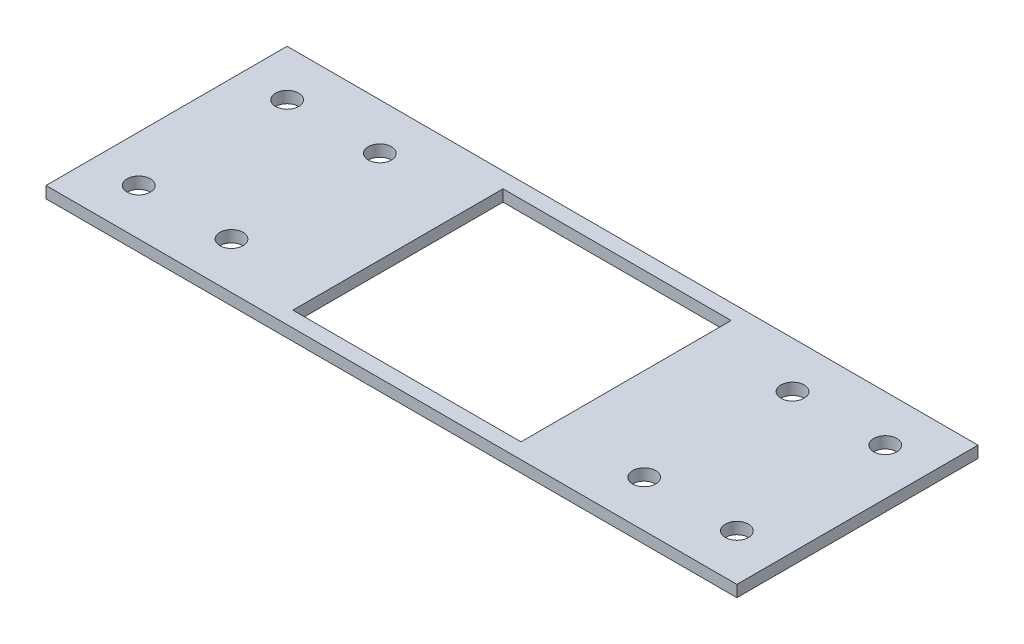
from build123d import *

# Parameters (mm, degrees)
SKETCH1_W           = 138.43
SKETCH1_H           = 66.04
BOSS_EXTRUDE1_DEPTH = 25.4
CUT_EXTRUDE1_REACH  = 146.563
SKETCH2_W           = 66.04
SKETCH2_H           = 22.225
SKETCH3_R           = 3.175
CUT_EXTRUDE2_DEPTH  = 77.753613921
SKETCH5_W           = 66.04
SKETCH5_H           = 3.175
BOSS_EXTRUDE2_DEPTH = 25.4
SKETCH7_W           = 66.04
SKETCH7_H           = 3.175
BOSS_EXTRUDE3_DEPTH = 25.4
CUT_EXTRUDE3_REACH  = 102.262
SKETCH8_R           = 3.175
SKETCH9_W           = 62.484
SKETCH9_H           = 57.5689222
CUT_EXTRUDE4_DEPTH  = 101.261653936


with BuildPart() as part:
    # Sketch1 → Boss-Extrude1 (new body)
    with BuildSketch(Plane(origin=(0, 0, 0), x_dir=(1, 0, 0), z_dir=(0, 1, 0))):
        Rectangle(SKETCH1_W, SKETCH1_H)
    extrude(amount=BOSS_EXTRUDE1_DEPTH)

    # Sketch2 → Cut-Extrude1 (cut, up to next)
    with BuildSketch(Plane.ZY.offset(69.215), mode=Mode.PRIVATE) as cut_extrude1_sk1:
        with Locations((0, 11.1125)):
            Rectangle(SKETCH2_W, SKETCH2_H)
    cut_extrude1_tool1 = extrude(cut_extrude1_sk1.sketch, amount=-CUT_EXTRUDE1_REACH, mode=Mode.PRIVATE) & part.part
    add(cut_extrude1_tool1.solids().sort_by_distance((-69.215, 11.1125, 0))[0], mode=Mode.SUBTRACT)

    # Sketch3 → Cut-Extrude2 (cut, through all)
    with BuildSketch(Plane(origin=(0, 25.4, 0), x_dir=(1, 0, 0), z_dir=(0, 1, 0))):
        with Locations((-56.515, 20.32)):
            Circle(SKETCH3_R)
        with Locations((-56.515, -20.32)):
            Circle(SKETCH3_R)
        with Locations((56.515, -20.32)):
            Circle(SKETCH3_R)
        with Locations((56.515, 20.32)):
            Circle(SKETCH3_R)
    extrude(amount=-CUT_EXTRUDE2_DEPTH, mode=Mode.SUBTRACT)

    # Sketch5 → Boss-Extrude2 (add)
    with BuildSketch(Plane.ZY.offset(69.215)):
        with Locations((0, 23.8125)):
            Rectangle(SKETCH5_W, SKETCH5_H)
    extrude(amount=BOSS_EXTRUDE2_DEPTH)

    # Sketch7 → Boss-Extrude3 (add)
    with BuildSketch(Plane(origin=(69.215, 0, 0), x_dir=(0, 0, -1), z_dir=(1, 0, 0))):
        with Locations((0, 23.8125)):
            Rectangle(SKETCH7_W, SKETCH7_H)
    extrude(amount=BOSS_EXTRUDE3_DEPTH)

    # Sketch8 → Cut-Extrude3 (cut, up to next)
    with BuildSketch(Plane(origin=(0, 25.4, 0), x_dir=(1, 0, 0), z_dir=(0, 1, 0)), mode=Mode.PRIVATE) as cut_extrude3_sk1:
        with Locations((-81.915, 20.32)):
            Circle(SKETCH8_R)
    cut_extrude3_tool1 = extrude(cut_extrude3_sk1.sketch, amount=-CUT_EXTRUDE3_REACH, mode=Mode.PRIVATE) & part.part
    # Sketch8 → Cut-Extrude3 (cut, up to next)
    with BuildSketch(Plane(origin=(0, 25.4, 0), x_dir=(1, 0, 0), z_dir=(0, 1, 0)), mode=Mode.PRIVATE) as cut_extrude3_sk2:
        with Locations((-81.915, -20.32)):
            Circle(SKETCH8_R)
    cut_extrude3_tool2 = extrude(cut_extrude3_sk2.sketch, amount=-CUT_EXTRUDE3_REACH, mode=Mode.PRIVATE) & part.part
    # Sketch8 → Cut-Extrude3 (cut, up to next)
    with BuildSketch(Plane(origin=(0, 25.4, 0), x_dir=(1, 0, 0), z_dir=(0, 1, 0)), mode=Mode.PRIVATE) as cut_extrude3_sk3:
        with Locations((81.915, -20.32)):
            Circle(SKETCH8_R)
    cut_extrude3_tool3 = extrude(cut_extrude3_sk3.sketch, amount=-CUT_EXTRUDE3_REACH, mode=Mode.PRIVATE) & part.part
    # Sketch8 → Cut-Extrude3 (cut, up to next)
    with BuildSketch(Plane(origin=(0, 25.4, 0), x_dir=(1, 0, 0), z_dir=(0, 1, 0)), mode=Mode.PRIVATE) as cut_extrude3_sk4:
        with Locations((81.915, 20.32)):
            Circle(SKETCH8_R)
    cut_extrude3_tool4 = extrude(cut_extrude3_sk4.sketch, amount=-CUT_EXTRUDE3_REACH, mode=Mode.PRIVATE) & part.part
    add(cut_extrude3_tool1.solids().sort_by_distance((-81.915, 25.4, -20.32))[0], mode=Mode.SUBTRACT)
    add(cut_extrude3_tool2.solids().sort_by_distance((-81.915, 25.4, 20.32))[0], mode=Mode.SUBTRACT)
    add(cut_extrude3_tool3.solids().sort_by_distance((81.915, 25.4, 20.32))[0], mode=Mode.SUBTRACT)
    add(cut_extrude3_tool4.solids().sort_by_distance((81.915, 25.4, -20.32))[0], mode=Mode.SUBTRACT)

    # Sketch9 → Cut-Extrude4 (cut, through all)
    with BuildSketch(Plane(origin=(0, 25.4, 0), x_dir=(1, 0, 0), z_dir=(0, 1, 0))):
        Rectangle(SKETCH9_W, SKETCH9_H)
    extrude(amount=-CUT_EXTRUDE4_DEPTH, mode=Mode.SUBTRACT)


solid = part.part
